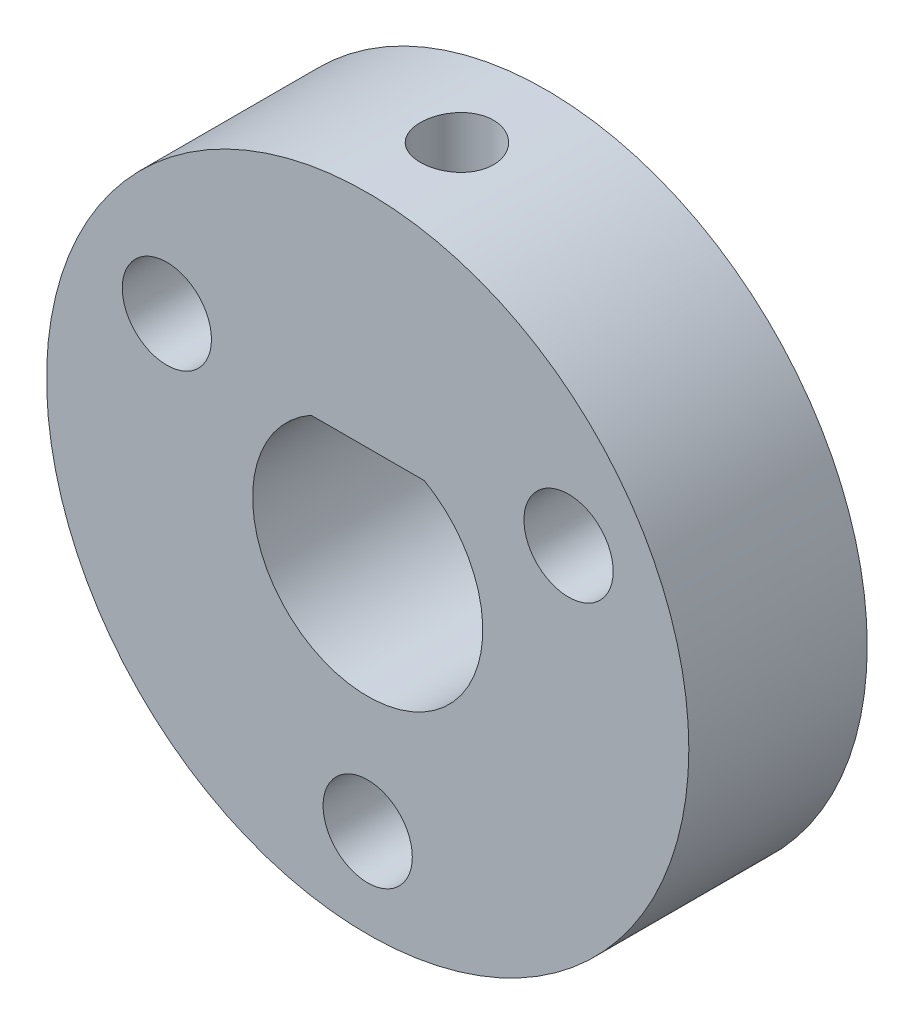
from build123d import *

# Parameters (mm, degrees)
SKETCH1_R              = 9
BOSS_EXTRUDE1_DEPTH    = 2.5
M2_5_CLEARANCE_HOLE2_D = 2.5
CIRPATTERN1_COUNT      = 3
SKETCH7_W              = 1.025
SKETCH7_H              = 6.192782739


with BuildPart() as part:
    # Sketch1 → Boss-Extrude1 (new, symmetric)
    with BuildSketch(Plane.XY):
        Circle(SKETCH1_R)
        with BuildLine():
            Line((-1.5875, 2.807217261), (1.5875, 2.807217261))
            ThreePointArc((1.5875, 2.807217261), (0, -3.225), (-1.5875, 2.807217261))
        make_face(mode=Mode.SUBTRACT)
    extrude(amount=BOSS_EXTRUDE1_DEPTH, both=True)

    # M2.5 Clearance Hole2 (through all)
    with Locations(Plane.XY.offset(2.5)):
        with Locations((0, -6.5)):
            m2_5_clearance_hole2 = Hole(M2_5_CLEARANCE_HOLE2_D / 2)

    # CirPattern1: M2.5 Clearance Hole2 ×3 about axis
    cirpattern1_axis = Axis((0, 0, 2.5), (0, 0, -1))
    for i in range(1, CIRPATTERN1_COUNT):
        add(m2_5_clearance_hole2.rotate(cirpattern1_axis, i * 360 / CIRPATTERN1_COUNT), mode=Mode.SUBTRACT)

    # Sketch7 → M2.5x0.45 Tapped Hole1 (revolve, cut)
    with BuildSketch(Plane(origin=(0, 2.807217261, 0), x_dir=(0, 0, -1), z_dir=(1, 0, 0))):
        with Locations((0.5125, 3.09639137)):
            Rectangle(SKETCH7_W, SKETCH7_H)
    revolve(axis=Axis((0, -3.542782739, 0), (0, 1, 0)), mode=Mode.SUBTRACT)


solid = part.part
